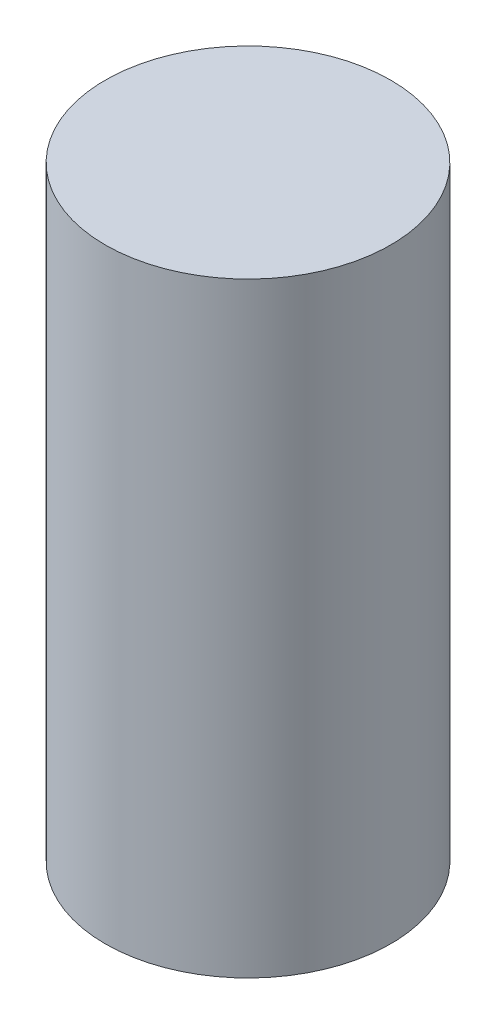
from build123d import *

# Parameters (mm, degrees)
PROFILE_SKETCH_R      = 50
PROFILE_EXTRUDE_DEPTH = 212


with BuildPart() as part:
    # Profile Sketch → Profile Extrude (new body)
    with BuildSketch(Plane(origin=(0, 0, 0), x_dir=(1, 0, 0), z_dir=(0, 1, 0))):
        Circle(PROFILE_SKETCH_R)
    extrude(amount=-PROFILE_EXTRUDE_DEPTH)


solid = part.part
